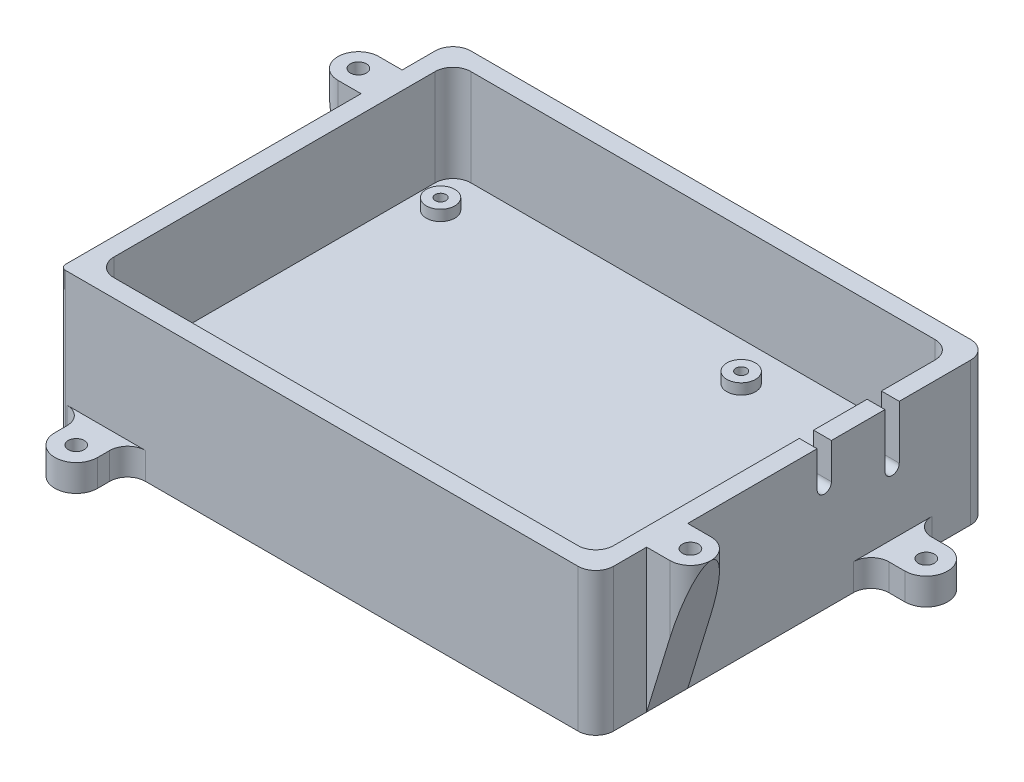
from build123d import *
from build123d.topology import SkipClean

# Parameters (mm, degrees)
SKETCH1_W           = 150
SKETCH1_H           = 110
BOSS_EXTRUDE1_DEPTH = 40
SHELL1_T            = -5
SKETCH2_R           = 6
SKETCH2_R_2         = 2.25
BOSS_EXTRUDE2_DEPTH = 7.5
SKETCH3_W           = 100
SKETCH3_H           = 100
BOSS_EXTRUDE3_DEPTH = 8
SKETCH4_W           = 99
SKETCH4_H           = 99
CUT_EXTRUDE1_DEPTH  = 8
SKETCH6_R           = 4
SKETCH6_R_2         = 1.5
BOSS_EXTRUDE4_DEPTH = 3
SKETCH7_R           = 1.5
CUT_EXTRUDE2_DEPTH  = 117.496977326
FILLET1_R           = 5
FILLET2_R           = 1.5
SKETCH8_R           = 2.25
BOSS_EXTRUDE5_DEPTH = 5
BOSS_EXTRUDE6_START = 8
BOSS_EXTRUDE6_DEPTH = 8
SKETCH10_R          = 2
CUT_EXTRUDE3_DEPTH  = 10
BOSS_EXTRUDE7_START = 8
SKETCH11_W          = 99
SKETCH11_H          = 99
SKETCH11_R          = 1.5
BOSS_EXTRUDE7_DEPTH = 8
SKETCH12_R          = 2.25
BOSS_EXTRUDE8_DEPTH = 35
CUT_EXTRUDE4_DEPTH  = 40
CUT_EXTRUDE5_DEPTH  = 130


with BuildPart() as part:
    # Sketch1 → Boss-Extrude1 (new body)
    with BuildSketch(Plane(origin=(0, 0, 0), x_dir=(1, 0, 0), z_dir=(0, 1, 0))):
        Rectangle(SKETCH1_W, SKETCH1_H)
    extrude(amount=BOSS_EXTRUDE1_DEPTH)

    # Shell1
    shell1_openings = [part.faces().sort_by_distance(p)[0] for p in [
        (0, 40, 0),
    ]]
    offset(amount=SHELL1_T, openings=shell1_openings, kind=Kind.INTERSECTION)

    # Sketch2 → Boss-Extrude2 (add)
    # profile 1 of 4: a face of its own
    with BuildSketch(Plane.XZ):
        with Locations((84.450112608, -28.114678388)):
            Circle(SKETCH2_R)
        with Locations(Location((84.450112608, -28.114678388, 0), (0, 0, 270))):
            Circle(SKETCH2_R_2, mode=Mode.SUBTRACT)
    # profile 2 of 4: a face of its own
    with BuildSketch(Plane.XZ):
        with BuildLine():
            ThreePointArc((84.450112608, -34.114678388), (78.450112608, -28.114678388), (84.450112608, -22.114678388))
            Line((84.450112608, -22.114678388), (75, -22.114678388))
            Line((75, -22.114678388), (75, -34.114678388))
            Line((75, -34.114678388), (84.450112608, -34.114678388))
        make_face()
    # profile 3 of 4: a face of its own
    with BuildSketch(Plane.XZ):
        with Locations((-62.149887392, 63.385321612)):
            Circle(SKETCH2_R)
        with Locations(Location((-62.149887392, 63.385321612, 0), (0, 0, 270))):
            Circle(SKETCH2_R_2, mode=Mode.SUBTRACT)
    # profile 4 of 4: a face of its own
    with BuildSketch(Plane.XZ):
        with BuildLine():
            Line((-68.149887392, 55), (-56.149887392, 55))
            Line((-56.149887392, 55), (-56.149887392, 63.385321612))
            ThreePointArc((-56.149887392, 63.385321612), (-62.149887392, 57.385321612), (-68.149887392, 63.385321612))
            Line((-68.149887392, 63.385321612), (-68.149887392, 55))
        make_face()
    extrude(amount=-BOSS_EXTRUDE2_DEPTH)

    # Sketch3 → Boss-Extrude3 (add)
    with BuildSketch(Plane(origin=(0, 5, 0), x_dir=(1, 0, 0), z_dir=(0, 1, 0))):
        with Locations((-20, 0)):
            Rectangle(SKETCH3_W, SKETCH3_H)
    extrude(amount=BOSS_EXTRUDE3_DEPTH)

    # Sketch4 → Cut-Extrude1 (cut)
    with BuildSketch(Plane.XZ):
        with Locations((-20, 0)):
            Rectangle(SKETCH4_W, SKETCH4_H)
    extrude(amount=-CUT_EXTRUDE1_DEPTH, mode=Mode.SUBTRACT)

    # Sketch6 → Boss-Extrude4 (add)
    # profile 1 of 4: a face of its own
    with BuildSketch(Plane(origin=(0, 13, 0), x_dir=(1, 0, 0), z_dir=(0, 1, 0))):
        with Locations(Location((21.54565415, 39.178286409, 0), (0, 0, 270))):
            Circle(SKETCH6_R)
        with Locations(Location((21.54565415, 39.178286409, 0), (0, 0, 270))):
            Circle(SKETCH6_R_2, mode=Mode.SUBTRACT)
    # profile 2 of 4: a face of its own
    with BuildSketch(Plane(origin=(0, 13, 0), x_dir=(1, 0, 0), z_dir=(0, 1, 0))):
        with Locations(Location((21.54565415, -35.021713591, 0), (0, 0, 270))):
            Circle(SKETCH6_R)
        with Locations(Location((21.54565415, -35.021713591, 0), (0, 0, 270))):
            Circle(SKETCH6_R_2, mode=Mode.SUBTRACT)
    # profile 3 of 4: a face of its own
    with BuildSketch(Plane(origin=(0, 13, 0), x_dir=(1, 0, 0), z_dir=(0, 1, 0))):
        with Locations(Location((-62.65434585, -35.021713591, 0), (0, 0, 270))):
            Circle(SKETCH6_R)
        with Locations(Location((-62.65434585, -35.021713591, 0), (0, 0, 270))):
            Circle(SKETCH6_R_2, mode=Mode.SUBTRACT)
    # profile 4 of 4: a face of its own
    with BuildSketch(Plane(origin=(0, 13, 0), x_dir=(1, 0, 0), z_dir=(0, 1, 0))):
        with Locations(Location((-62.65434585, 39.178286409, 0), (0, 0, 270))):
            Circle(SKETCH6_R)
        with Locations(Location((-62.65434585, 39.178286409, 0), (0, 0, 270))):
            Circle(SKETCH6_R_2, mode=Mode.SUBTRACT)
    extrude(amount=BOSS_EXTRUDE4_DEPTH)

    # Sketch7 → Cut-Extrude2 (cut, through all)
    with SkipClean():  # the faces are left unmerged after this step: merging them gives an invalid solid
        with BuildSketch(Plane(origin=(0, 16, 0), x_dir=(1, 0, 0), z_dir=(0, 1, 0))):
            with Locations(Location((-62.65434585, -35.021713591, 0), (0, 0, 90))):
                Circle(SKETCH7_R)
            with Locations(Location((-62.65434585, 39.178286409, 0), (0, 0, 90))):
                Circle(SKETCH7_R)
            with Locations(Location((21.54565415, -35.021713591, 0), (0, 0, 90))):
                Circle(SKETCH7_R)
            with Locations(Location((21.54565415, 39.178286409, 0), (0, 0, 90))):
                Circle(SKETCH7_R)
        extrude(amount=-CUT_EXTRUDE2_DEPTH, mode=Mode.SUBTRACT)
    add(part.part.scale(1), mode=Mode.REPLACE)  # the faces are merged on a copy

    # Fillet1
    fillet1_edges = [part.edges().sort_by_distance(p)[0] for p in [
        (70, 22.5, 50),
        (70, 22.5, -50),
        (-70, 26.5, -50),
        (-70, 26.5, 50),
        (75, 3.75, -34.114678388),
        (75, 3.75, -22.114678388),
        (-56.149887392, 3.75, 55),
        (-68.149887392, 3.75, 55),
        (75, 20, 55),
        (-75, 20, -55),
        (75, 20, -55),
    ]]
    fillet(fillet1_edges, radius=FILLET1_R)

    # Fillet2
    fillet2_edges = [part.edges().sort_by_distance(p)[0] for p in [
        (-75, 20, 55),
    ]]
    fillet(fillet2_edges, radius=FILLET2_R)

    # Sketch8 → Boss-Extrude5 (add)
    # profile 1 of 2: a face of its own
    with BuildSketch(Plane(origin=(0, 40, 0), x_dir=(1, 0, 0), z_dir=(0, 1, 0))):
        with BuildLine():
            Line((-75, 40.75), (-81.5, 40.75))
            ThreePointArc((-81.5, 40.75), (-87.25, 35), (-81.5, 29.25))
            Line((-81.5, 29.25), (-75, 29.25))
            Line((-75, 29.25), (-75, 40.75))
        make_face()
        with Locations(Location((-81.5, 35, 0), (0, 0, 270))):
            Circle(SKETCH8_R, mode=Mode.SUBTRACT)
    # profile 2 of 2: a face of its own
    with BuildSketch(Plane(origin=(0, 40, 0), x_dir=(1, 0, 0), z_dir=(0, 1, 0))):
        with BuildLine():
            Line((75, -40.75), (81.5, -40.75))
            ThreePointArc((81.5, -40.75), (87.25, -35), (81.5, -29.25))
            Line((81.5, -29.25), (75, -29.25))
            Line((75, -29.25), (75, -40.75))
        make_face()
        with Locations(Location((81.5, -35, 0), (0, 0, 270))):
            Circle(SKETCH8_R, mode=Mode.SUBTRACT)
    extrude(amount=-BOSS_EXTRUDE5_DEPTH)

    # Sketch9 → Boss-Extrude6 (add)
    with BuildSketch(Plane(origin=(0, 5, 0), x_dir=(1, 0, 0), z_dir=(0, 1, 0)).offset(BOSS_EXTRUDE6_START)):
        with BuildLine():
            Line((30, -50), (65, -50))
            ThreePointArc((65, -50), (68.535533906, -48.535533906), (70, -45))
            Line((70, -45), (70, 45))
            ThreePointArc((70, 45), (68.535533906, 48.535533906), (65, 50))
            Line((65, 50), (30, 50))
            Line((30, 50), (30, -50))
        make_face()
    extrude(amount=-BOSS_EXTRUDE6_DEPTH)

    # Sketch10 → Cut-Extrude3 (cut)
    with BuildSketch(Plane(origin=(75, 0, 0), x_dir=(0, 0, -1), z_dir=(1, 0, 0))):
        with BuildLine():
            Line((7, 40), (7, 30))
            ThreePointArc((7, 30), (9, 32), (11, 30))
            Line((11, 30), (11, 40))
            Line((11, 40), (7, 40))
        make_face()
        with Locations((9, 30)):
            Circle(SKETCH10_R)
        with BuildLine():
            Line((30, 40), (26, 40))
            Line((26, 40), (26, 25))
            ThreePointArc((26, 25), (28, 27), (30, 25))
            Line((30, 25), (30, 40))
        make_face()
        with Locations((28, 25)):
            Circle(SKETCH10_R)
    extrude(amount=-CUT_EXTRUDE3_DEPTH, mode=Mode.SUBTRACT)

    # Sketch11 → Boss-Extrude7 (add)
    with BuildSketch(Plane.XZ.offset(-8).offset(BOSS_EXTRUDE7_START)):
        with Locations((-20, 0)):
            Rectangle(SKETCH11_W, SKETCH11_H)
        with Locations(Location((21.54565415, 35.021713591, 0), (0, 0, 270))):
            Circle(SKETCH11_R, mode=Mode.SUBTRACT)
        with Locations(Location((-62.65434585, 35.021713591, 0), (0, 0, 270))):
            Circle(SKETCH11_R, mode=Mode.SUBTRACT)
        with Locations(Location((21.54565415, -39.178286409, 0), (0, 0, 270))):
            Circle(SKETCH11_R, mode=Mode.SUBTRACT)
        with Locations(Location((-62.65434585, -39.178286409, 0), (0, 0, 270))):
            Circle(SKETCH11_R, mode=Mode.SUBTRACT)
    extrude(amount=-BOSS_EXTRUDE7_DEPTH)

    # Sketch12 → Boss-Extrude8 (add)
    # profile 1 of 2: a face of its own
    with SkipClean():  # the faces are left unmerged after this step: merging them gives an invalid solid
        with BuildSketch(Plane.XZ.offset(-35)):
            with BuildLine():
                ThreePointArc((-81.5, -29.25), (-87.25, -35), (-81.5, -40.75))
                Line((-81.5, -40.75), (-75, -40.75))
                Line((-75, -40.75), (-75, -29.25))
                Line((-75, -29.25), (-81.5, -29.25))
            make_face()
            with Locations((-81.5, -35)):
                Circle(SKETCH12_R, mode=Mode.SUBTRACT)
        # profile 2 of 2: a face of its own
        with BuildSketch(Plane.XZ.offset(-35)):
            with BuildLine():
                ThreePointArc((81.5, 29.25), (87.25, 35), (81.5, 40.75))
                Line((81.5, 40.75), (75, 40.75))
                Line((75, 40.75), (75, 29.25))
                Line((75, 29.25), (81.5, 29.25))
            make_face()
        extrude(amount=BOSS_EXTRUDE8_DEPTH)
    add(part.part.scale(1), mode=Mode.REPLACE)  # the faces are merged on a copy

    # Sketch13 → Cut-Extrude4 (cut)
    with BuildSketch(Plane.XY.offset(55)):
        Polygon((87.25, 0), (87.25, 40), (81.5, 21.224489796), (81.5, 0), align=None)
        Polygon((81.5, 0), (81.5, 21.224489796), (75, 0), align=None)
        Polygon((-75, 0), (-81.5, 21.224489796), (-81.5, 0), align=None)
        Polygon((-81.5, 21.224489796), (-87.25, 40), (-87.25, 0), (-81.5, 0), align=None)
    extrude(amount=-CUT_EXTRUDE4_DEPTH, mode=Mode.SUBTRACT)

    # Sketch14 → Cut-Extrude5 (cut)
    with BuildSketch(Plane.XY.offset(55)):
        Polygon((-81.5, 21.224489796), (-81.5, 0), (-75, 0), align=None)
        Polygon((-87.25, 0), (-81.5, 0), (-81.5, 21.224489796), (-87.25, 40), align=None)
    extrude(amount=-CUT_EXTRUDE5_DEPTH, mode=Mode.SUBTRACT)


solid = part.part
